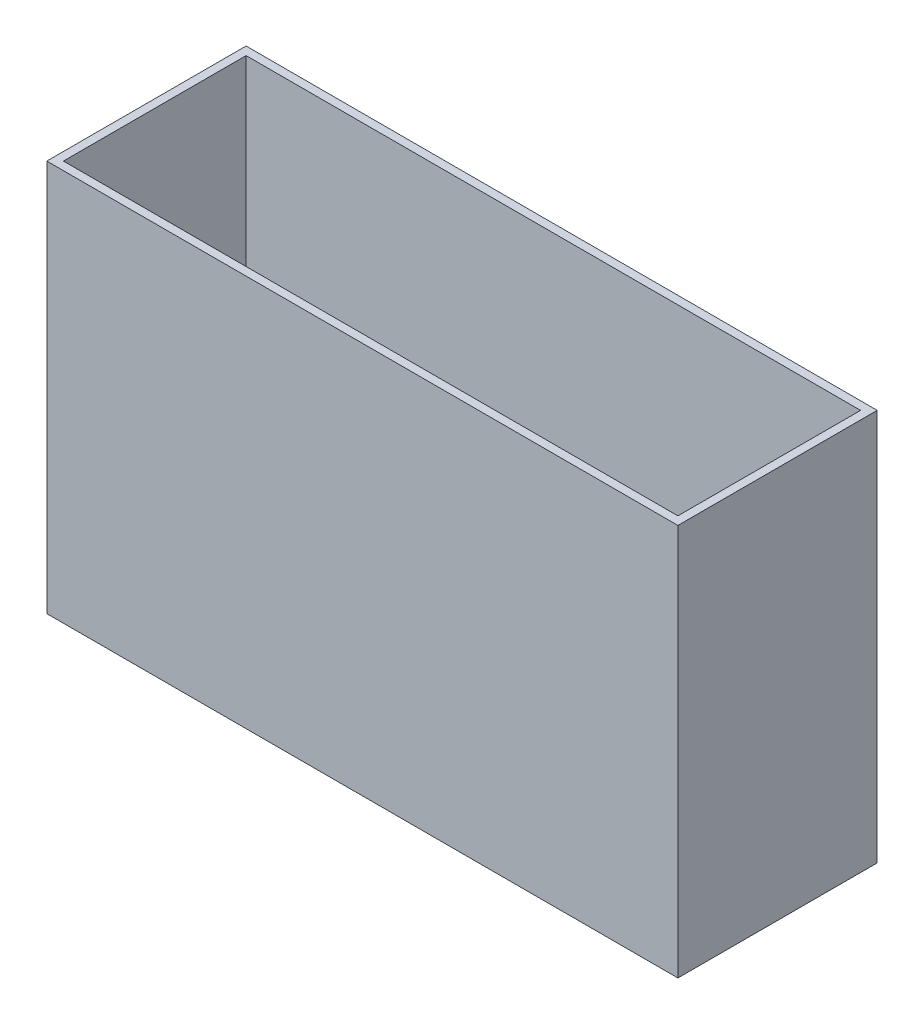
from build123d import *

# Parameters (mm, degrees)
SKETCH1_W           = 241.3
SKETCH1_H           = 76.2
SKETCH1_W_2         = 205.74
SKETCH1_H_2         = 5.588
BOSS_EXTRUDE1_DEPTH = 149.86
SHELL1_T            = -3.175


with BuildPart() as part:
    # Sketch1 → Boss-Extrude1 (new body)
    with BuildSketch(Plane(origin=(0, 0, 0), x_dir=(1, 0, 0), z_dir=(0, 1, 0))):
        Rectangle(SKETCH1_W, SKETCH1_H)
        Rectangle(SKETCH1_W_2, SKETCH1_H_2, mode=Mode.SUBTRACT)
    extrude(amount=BOSS_EXTRUDE1_DEPTH)

    # Shell1
    shell1_openings = [part.faces().sort_by_distance(p)[0] for p in [
        (0, 0, -35.569542927),
        (0, 74.93, -2.794),
        (0, 74.93, 2.794),
        (-102.87, 74.93, 0),
        (102.87, 74.93, 0),
        (0, 149.86, -35.569542927),
    ]]
    offset(amount=SHELL1_T, openings=shell1_openings, kind=Kind.INTERSECTION)


solid = part.part
